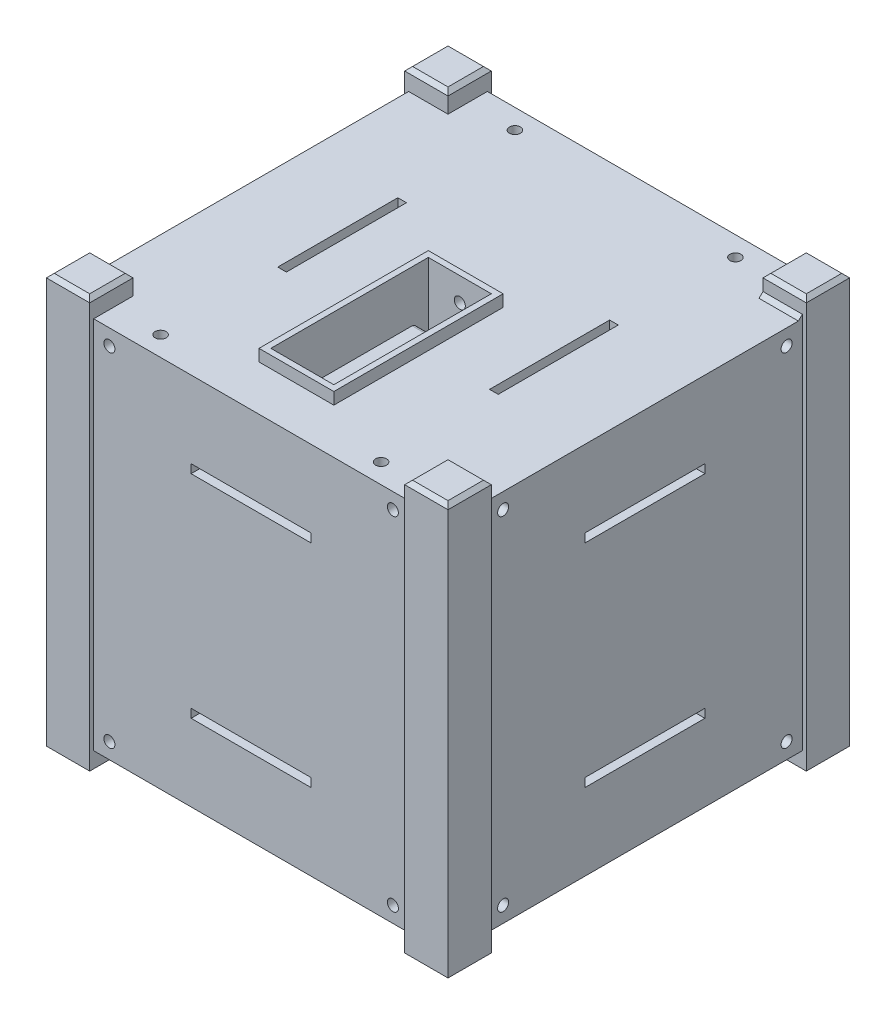
from build123d import *

# Parameters (mm, degrees)
SKETCH1_W                       = 100
SKETCH1_H                       = 100
BOSS_EXTRUDE1_DEPTH             = 95
SKETCH2_W                       = 10
SKETCH2_H                       = 10
BOSS_EXTRUDE2_DEPTH             = 105
SKETCH3_R                       = 1.4
CUT_EXTRUDE1_DEPTH              = 10
SKETCH4_W                       = 11
SKETCH4_H                       = 11
BOSS_EXTRUDE3_DEPTH             = 105
SKETCH5_R                       = 1.4
CUT_EXTRUDE2_DEPTH              = 10
SKETCH6_R                       = 1.4
CUT_EXTRUDE3_DEPTH              = 10
CHAMFER1_SIZE                   = 1
SKETCH7_W                       = 19
SKETCH7_H                       = 43
SKETCH7_W_2                     = 16
SKETCH7_H_2                     = 40
BOSS_EXTRUDE4_DEPTH             = 3
SKETCH8_W                       = 16
SKETCH8_H                       = 40
CUT_EXTRUDE4_DEPTH              = 10
CHAMFER2_SIZE                   = 13
SKETCH9_W                       = 16
SKETCH9_H                       = 3.1
CUT_EXTRUDE5_DEPTH              = 10
FILLET1_R                       = 1
SKETCH10_R                      = 1.4
CUT_EXTRUDE6_DEPTH              = 10
SKETCH12_W                      = 30.5
SKETCH12_H                      = 2.2
CUT_EXTRUDE7_DEPTH              = 3
SKETCH13_W                      = 30.5
SKETCH13_H                      = 2.2
CUT_EXTRUDE8_DEPTH              = 3
SKETCH14_W                      = 2.2
SKETCH14_H                      = 30.5
CUT_EXTRUDE9_DEPTH              = 3
CUT_EXTRUDE10_DEPTH             = 45
CUT_EXTRUDE10_DEPTH_BACK        = 45
SKETCH15_W                      = 90
SKETCH15_H                      = 58
CUT_EXTRUDE11_REACH             = 125.296
CUT_EXTRUDE11_DIRECTION_2_REACH = 125.296
CHAMFER3_SIZE                   = 4


with BuildPart() as part:
    # Sketch1 → Boss-Extrude1 (new body)
    with BuildSketch(Plane(origin=(0, 0, 0), x_dir=(1, 0, 0), z_dir=(0, 1, 0))):
        Rectangle(SKETCH1_W, SKETCH1_H)
    extrude(amount=BOSS_EXTRUDE1_DEPTH)

    # Sketch2 → Boss-Extrude2 (add)
    with BuildSketch(Plane(origin=(0, 100, 0), x_dir=(1, 0, 0), z_dir=(0, 1, 0))):
        with Locations((-45, 45)):
            Rectangle(SKETCH2_W, SKETCH2_H)
        with Locations((45, 45)):
            Rectangle(SKETCH2_W, SKETCH2_H)
        with Locations((45, -45)):
            Rectangle(SKETCH2_W, SKETCH2_H)
        with Locations((-45, -45)):
            Rectangle(SKETCH2_W, SKETCH2_H)
    extrude(amount=-BOSS_EXTRUDE2_DEPTH)

    # Sketch3 → Cut-Extrude1 (cut)
    with BuildSketch(Plane(origin=(0, 95, 0), x_dir=(1, 0, 0), z_dir=(0, 1, 0))):
        with Locations(Location((-28, -45, 0), (0, 0, 270))):
            Circle(SKETCH3_R)
        with Locations(Location((28, -45, 0), (0, 0, 90))):
            Circle(SKETCH3_R)
        with Locations(Location((28, 45, 0), (0, 0, 270))):
            Circle(SKETCH3_R)
        with Locations(Location((-28, 45, 0), (0, 0, 90))):
            Circle(SKETCH3_R)
    cut_extrude1 = extrude(amount=-CUT_EXTRUDE1_DEPTH, mode=Mode.SUBTRACT)

    # Sketch4 → Boss-Extrude3 (add)
    with BuildSketch(Plane(origin=(0, 100, 0), x_dir=(1, 0, 0), z_dir=(0, 1, 0))):
        with Locations((-45.5, 45.5)):
            Rectangle(SKETCH4_W, SKETCH4_H)
        with Locations((45.5, 45.5)):
            Rectangle(SKETCH4_W, SKETCH4_H)
        with Locations((45.5, -45.5)):
            Rectangle(SKETCH4_W, SKETCH4_H)
        with Locations((-45.5, -45.5)):
            Rectangle(SKETCH4_W, SKETCH4_H)
    extrude(amount=-BOSS_EXTRUDE3_DEPTH)

    # Sketch5 → Cut-Extrude2 (cut)
    with BuildSketch(Plane.XY.offset(50)):
        with Locations((-36, 91)):
            Circle(SKETCH5_R)
        with Locations(Location((36, 91, 0), (0, 0, 180))):
            Circle(SKETCH5_R)
        with Locations((36, 4)):
            Circle(SKETCH5_R)
        with Locations(Location((-36, 4, 0), (0, 0, 180))):
            Circle(SKETCH5_R)
    cut_extrude2 = extrude(amount=-CUT_EXTRUDE2_DEPTH, mode=Mode.SUBTRACT)

    # Mirror1: Cut-Extrude2 across plane
    add(cut_extrude2.mirror(Plane.XY), mode=Mode.SUBTRACT)

    # Sketch6 → Cut-Extrude3 (cut)
    with BuildSketch(Plane.ZY.offset(50)):
        with Locations((-36, 91)):
            Circle(SKETCH6_R)
        with Locations(Location((36, 91, 0), (0, 0, 180))):
            Circle(SKETCH6_R)
        with Locations((36, 4)):
            Circle(SKETCH6_R)
        with Locations(Location((-36, 4, 0), (0, 0, 180))):
            Circle(SKETCH6_R)
    cut_extrude3 = extrude(amount=-CUT_EXTRUDE3_DEPTH, mode=Mode.SUBTRACT)

    # Mirror2: Cut-Extrude3 across plane
    add(cut_extrude3.mirror(Plane(origin=(0, 0, 0), x_dir=(0, 0, 1), z_dir=(1, 0, 0))), mode=Mode.SUBTRACT)

    # Mirror3: Cut-Extrude1 across plane
    add(cut_extrude1.mirror(Plane.ZX.offset(47.5)), mode=Mode.SUBTRACT)

    # Chamfer1
    chamfer1_edges = [part.edges().sort_by_distance(p)[0] for p in [
        (-45.5, -5, 51),
        (-51, -5, 45.5),
        (-51, 100, 45.5),
        (-45.5, 100, 51),
        (51, -5, 45.5),
        (45.5, -5, 51),
        (45.5, 100, 51),
        (51, 100, 45.5),
        (45.5, -5, -51),
        (51, -5, -45.5),
        (51, 100, -45.5),
        (45.5, 100, -51),
        (-51, -5, -45.5),
        (-45.5, -5, -51),
        (-45.5, 100, -51),
        (-51, 100, -45.5),
        (-45.5, -5, 40),
        (-40, -5, 45.5),
        (-40, 100, 45.5),
        (-45.5, 100, 40),
        (40, -5, 45.5),
        (45.5, -5, 40),
        (45.5, 100, 40),
        (40, 100, 45.5),
        (45.5, -5, -40),
        (40, -5, -45.5),
        (45, 95, -40),
        (40, 100, -45.5),
        (45.5, 100, -40),
        (-40, -5, -45.5),
        (-45.5, -5, -40),
        (-45.5, 100, -40),
        (-40, 100, -45.5),
    ]]
    chamfer(chamfer1_edges, length=CHAMFER1_SIZE)

    # Sketch7 → Boss-Extrude4 (add)
    with BuildSketch(Plane(origin=(0, 95, 0), x_dir=(1, 0, 0), z_dir=(0, 1, 0))):
        with Locations((0, -17)):
            Rectangle(SKETCH7_W, SKETCH7_H)
        with Locations((0, -17)):
            Rectangle(SKETCH7_W_2, SKETCH7_H_2, mode=Mode.SUBTRACT)
    extrude(amount=BOSS_EXTRUDE4_DEPTH)

    # Sketch8 → Cut-Extrude4 (cut)
    with BuildSketch(Plane(origin=(0, 95, 0), x_dir=(1, 0, 0), z_dir=(0, 1, 0))):
        with Locations((0, -17)):
            Rectangle(SKETCH8_W, SKETCH8_H)
    extrude(amount=-CUT_EXTRUDE4_DEPTH, mode=Mode.SUBTRACT)

    # Chamfer2
    chamfer2_edges = [part.edges().sort_by_distance(p)[0] for p in [
        (0, 85, 37),
    ]]
    chamfer(chamfer2_edges, length=CHAMFER2_SIZE - 0.0001)  # a hair under: the kernel refuses the full size

    # Sketch9 → Cut-Extrude5 (cut)
    with BuildSketch(Plane(origin=(0, 85, 0), x_dir=(1, 0, 0), z_dir=(0, 1, 0))):
        with Locations((0, 1.45)):
            Rectangle(SKETCH9_W, SKETCH9_H)
    extrude(amount=-CUT_EXTRUDE5_DEPTH, mode=Mode.SUBTRACT)

    # Fillet1
    fillet1_edges = [part.edges().sort_by_distance(p)[0] for p in [
        (0, 85, 0.1),
    ]]
    fillet(fillet1_edges, radius=FILLET1_R)

    # Sketch10 → Cut-Extrude6 (cut)
    with BuildSketch(Plane.XY.offset(-3)):
        with Locations((0, 92)):
            Circle(SKETCH10_R)
    extrude(amount=-CUT_EXTRUDE6_DEPTH, mode=Mode.SUBTRACT)

    # Sketch12 → Cut-Extrude7 (cut)
    with BuildSketch(Plane.ZY.offset(50)):
        with Locations((0, 74.4)):
            Rectangle(SKETCH12_W, SKETCH12_H)
        with Locations((0, 20.6)):
            Rectangle(SKETCH12_W, SKETCH12_H)
    cut_extrude7 = extrude(amount=-CUT_EXTRUDE7_DEPTH, mode=Mode.SUBTRACT)

    # Mirror4: Cut-Extrude7 across plane
    add(cut_extrude7.mirror(Plane(origin=(0, 0, 0), x_dir=(0, 0, 1), z_dir=(1, 0, 0))), mode=Mode.SUBTRACT)

    # Sketch13 → Cut-Extrude8 (cut)
    with BuildSketch(Plane.XY.offset(50)):
        with Locations((0, 74.4)):
            Rectangle(SKETCH13_W, SKETCH13_H)
        with Locations((0, 20.6)):
            Rectangle(SKETCH13_W, SKETCH13_H)
    cut_extrude8 = extrude(amount=-CUT_EXTRUDE8_DEPTH, mode=Mode.SUBTRACT)

    # Mirror5: Cut-Extrude8 across plane
    add(cut_extrude8.mirror(Plane.XY), mode=Mode.SUBTRACT)

    # Sketch14 → Cut-Extrude9 (cut)
    with BuildSketch(Plane(origin=(0, 95, 0), x_dir=(1, 0, 0), z_dir=(0, 1, 0))):
        with Locations((26.9, 0)):
            Rectangle(SKETCH14_W, SKETCH14_H)
        with Locations((-26.9, 0)):
            Rectangle(SKETCH14_W, SKETCH14_H)
    cut_extrude9 = extrude(amount=-CUT_EXTRUDE9_DEPTH, mode=Mode.SUBTRACT)

    # Mirror6: Cut-Extrude9 across plane
    add(cut_extrude9.mirror(Plane.ZX.offset(47.5)), mode=Mode.SUBTRACT)

    # Sketch15 → Cut-Extrude10 (cut, two sides: drawn at the far end of the back side and taken through both)
    with BuildSketch(Plane(origin=(0, 0, 0), x_dir=(0, 0, -1), z_dir=(1, 0, 0)).offset(-CUT_EXTRUDE10_DEPTH_BACK)):
        with Locations((0, 41)):
            Rectangle(SKETCH15_W, SKETCH15_H)
    extrude(amount=CUT_EXTRUDE10_DEPTH + CUT_EXTRUDE10_DEPTH_BACK, mode=Mode.SUBTRACT)

    # Cut-Extrude11: up to this face of the body (flat: up to its plane)
    cut_extrude11_end = Plane(part.part.faces().sort_by_distance((0, 41, 45))[0])
    # Sketch16 → Cut-Extrude11 (cut, up to the picked face)
    with BuildSketch(Plane.XY, mode=Mode.PRIVATE) as cut_extrude11_sk1:
        Polygon((45, 57.006357685), (-45, 57.006357685), (-45, 83), (-13, 83), (-13, 67.006357685), (13, 67.006357685), (13, 83), (45, 83), align=None)
    cut_extrude11_tool1 = split(extrude(cut_extrude11_sk1.sketch, amount=CUT_EXTRUDE11_REACH, mode=Mode.PRIVATE), bisect_by=cut_extrude11_end, keep=Keep.BOTH, mode=Mode.PRIVATE)
    add(cut_extrude11_tool1.solids().sort_by(Axis((0, 57.943143, 0), (0, 0, 1)))[0], mode=Mode.SUBTRACT)

    # Cut-Extrude11 direction 2: up to this face of the body (flat: up to its plane)
    cut_extrude11_direction_2_end = Plane(part.part.faces().sort_by_distance((0, 41, -45))[0])
    # Sketch16 → Cut-Extrude11 direction 2 (cut, up to the picked face)
    with BuildSketch(Plane.XY, mode=Mode.PRIVATE) as cut_extrude11_direction_2_sk1:
        Polygon((45, 57.006357685), (-45, 57.006357685), (-45, 83), (-13, 83), (-13, 67.006357685), (13, 67.006357685), (13, 83), (45, 83), align=None)
    cut_extrude11_direction_2_tool1 = split(extrude(cut_extrude11_direction_2_sk1.sketch, amount=-CUT_EXTRUDE11_DIRECTION_2_REACH, mode=Mode.PRIVATE), bisect_by=cut_extrude11_direction_2_end, keep=Keep.BOTH, mode=Mode.PRIVATE)
    add(cut_extrude11_direction_2_tool1.solids().sort_by(Axis((0, 57.943143, 0), (0, 0, -1)))[0], mode=Mode.SUBTRACT)

    # Chamfer3
    chamfer3_edges = [part.edges().sort_by_distance(p)[0] for p in [
        (13, 70, 0),
        (-13, 70, 0),
    ]]
    chamfer(chamfer3_edges, length=CHAMFER3_SIZE)


solid = part.part
